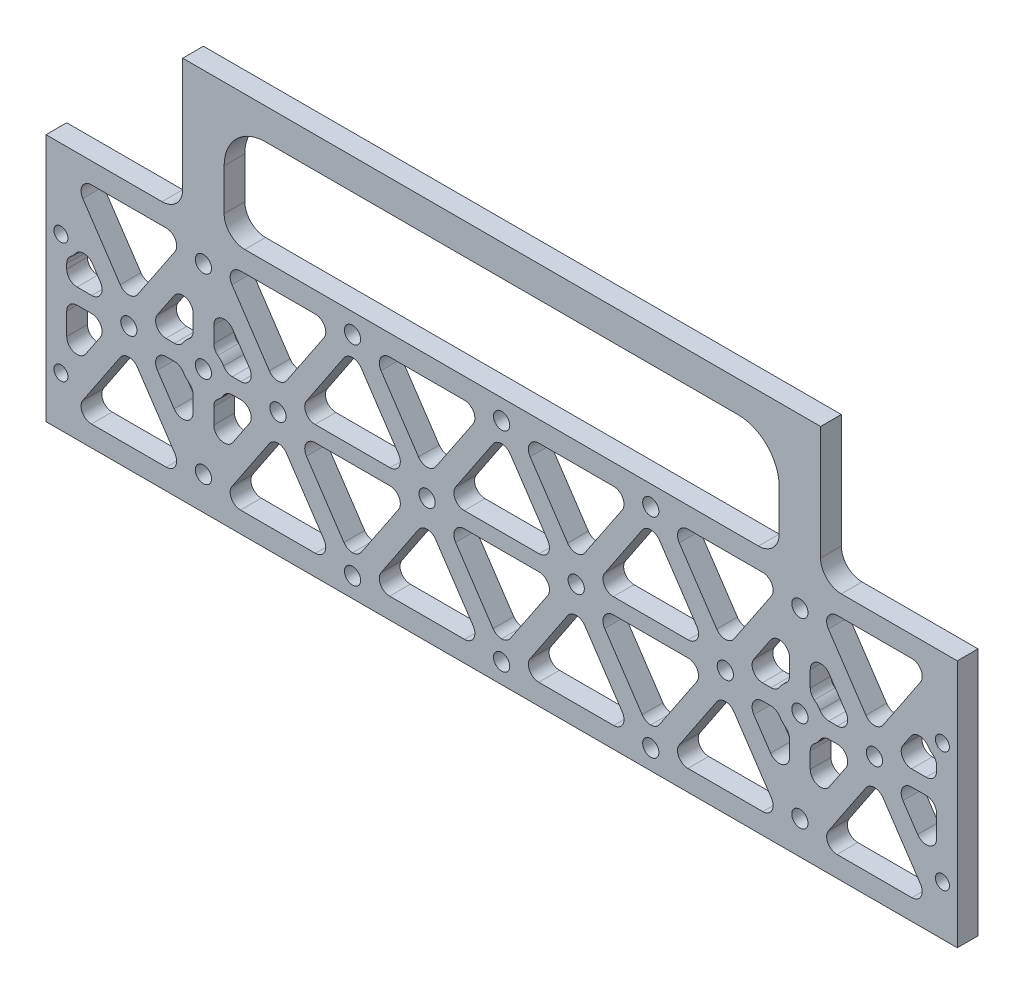
from build123d import *

# Parameters (mm, degrees)
SKETCH1_W              = 279.4
SKETCH1_H              = 76.2
BOSS_EXTRUDE1_DEPTH    = 6.35
F_10_CLEARANCE_HOLE1_D = 4.9784
BOSS_EXTRUDE2_DEPTH    = 6.35
FILLET1_R              = 12.7
FILLET1_OF_MIRROR1_R   = 12.7
FILLET2_R              = 6.35
FILLET3_R              = 6.35
F_8_CLEARANCE_HOLE1_D  = 4.3053
CUT_EXTRUDE1_DEPTH     = 161.800507229
FILLET4_R              = 3.175
FILLET5_R              = 3.175
SKETCH10_R             = 2.4892
CUT_EXTRUDE2_DEPTH     = 161.800507229


with BuildPart() as part:
    # Sketch1 → Boss-Extrude1 (new body)
    with BuildSketch(Plane.XY):
        Rectangle(SKETCH1_W, SKETCH1_H)
    extrude(amount=BOSS_EXTRUDE1_DEPTH)

    # #10 Clearance Hole1 (through all)
    with Locations(Plane.XY.offset(6.35)):
        with Locations((-91.44, 27.94), (-91.44, -27.94), (91.44, 27.94), (91.44, -27.94), (-91.44, 0), (91.44, 0)):
            Hole(F_10_CLEARANCE_HOLE1_D / 2)

    # Sketch5 → Boss-Extrude2 (add)
    with BuildSketch(Plane.XY.offset(6.35)):
        Polygon((-97.79, 47.271427301), (-97.79, 38.1), (-85.09, 38.1), (-85.09, 69.85), (-97.79, 69.85), align=None)
        Polygon((-97.79, 69.85), (-85.09, 69.85), (0, 69.85), (0, 79.375), (-97.79, 79.375), align=None)
    boss_extrude2 = extrude(amount=-BOSS_EXTRUDE2_DEPTH)

    # Fillet1
    fillet1_edges = [part.edges().sort_by_distance(p)[0] for p in [
        (-85.09, 69.85, 3.175),
    ]]
    fillet(fillet1_edges, radius=FILLET1_R)

    # Mirror1: Boss-Extrude2 across plane
    add(boss_extrude2.mirror(Plane(origin=(0, 0, 0), x_dir=(0, 0, 1), z_dir=(1, 0, 0))))

    # Fillet1 of Mirror1
    fillet1_of_mirror1_edges = [part.edges().sort_by_distance(p)[0] for p in [
        (85.09, 69.85, 3.175),
    ]]
    fillet(fillet1_of_mirror1_edges, radius=FILLET1_OF_MIRROR1_R)

    # Fillet2
    fillet2_edges = [part.edges().sort_by_distance(p)[0] for p in [
        (-85.09, 38.1, 3.175),
        (85.09, 38.1, 3.175),
    ]]
    fillet(fillet2_edges, radius=FILLET2_R)

    # Fillet3
    fillet3_edges = [part.edges().sort_by_distance(p)[0] for p in [
        (-97.79, 38.1, 3.175),
        (97.79, 38.1, 3.175),
    ]]
    fillet(fillet3_edges, radius=FILLET3_R)

    # #8 Clearance Hole1 (through all)
    with Locations(Plane.XY.offset(6.35)):
        with Locations((-135.128, 13.97), (-135.128, -22.86), (135.128, 13.97), (135.128, -22.86)):
            Hole(F_8_CLEARANCE_HOLE1_D / 2)

    # Sketch9 → Cut-Extrude1 (cut, through all)
    with BuildSketch(Plane.XY.offset(6.35)):
        with BuildLine():
            Line((-119.734892292, -2.413), (-133.35, -2.413))
            Line((-133.35, -2.413), (-133.35, -12.306016373))
            ThreePointArc((-133.35, -12.306016373), (-131.097668245, -15.343994041), (-127.536262482, -14.07171434))
            Line((-127.536262482, -14.07171434), (-119.734892292, -2.413))
        make_face()
        with BuildLine():
            Line((-133.35, 8.947792266), (-133.35, 2.413))
            Line((-133.35, 2.413), (-119.734892292, 2.413))
            Line((-119.734892292, 2.413), (-125.45428983, 10.960321877))
            ThreePointArc((-125.45428983, 10.960321877), (-128.082481922, 12.369606397), (-130.719977554, 10.977811397))
            ThreePointArc((-130.719977554, 10.977811397), (-131.872702342, 9.752549149), (-133.35, 8.947792266))
        make_face()
        with BuildLine():
            ThreePointArc((-100.180935541, 26.809302033), (-100.019073476, 30.070749637), (-102.819673059, 31.75))
            Line((-102.819673059, 31.75), (-125.780326941, 31.75))
            ThreePointArc((-125.780326941, 31.75), (-128.580926524, 30.070749637), (-128.419064459, 26.809302033))
            Line((-128.419064459, 26.809302033), (-114.3, 5.709144591))
            Line((-114.3, 5.709144591), (-100.180935541, 26.809302033))
        make_face()
        with BuildLine():
            Line((-51.154892292, 31.75), (-80.060326941, 31.75))
            ThreePointArc((-80.060326941, 31.75), (-82.860926524, 30.070749637), (-82.699064459, 26.809302033))
            Line((-82.699064459, 26.809302033), (-68.58, 5.709144591))
            Line((-68.58, 5.709144591), (-51.154892292, 31.75))
        make_face()
        with BuildLine():
            ThreePointArc((-94.615, 21.349740063), (-95.19394704, 21.661462538), (-95.742564124, 22.023912357))
            Line((-95.742564124, 22.023912357), (-108.865107708, 2.413))
            Line((-108.865107708, 2.413), (-98.345764407, 2.413))
            ThreePointArc((-98.345764407, 2.413), (-96.895990094, 4.872814704), (-94.615, 6.590259937))
            Line((-94.615, 6.590259937), (-94.615, 21.349740063))
        make_face()
        with BuildLine():
            Line((-74.014892292, 2.413), (-87.137435876, 22.023912357))
            ThreePointArc((-87.137435876, 22.023912357), (-87.68605296, 21.661462538), (-88.265, 21.349740063))
            Line((-88.265, 21.349740063), (-88.265, 6.590259937))
            ThreePointArc((-88.265, 6.590259937), (-85.984009906, 4.872814704), (-84.534235593, 2.413))
            Line((-84.534235593, 2.413), (-74.014892292, 2.413))
        make_face()
        with BuildLine():
            ThreePointArc((-94.615, -6.590259937), (-96.895990094, -4.872814704), (-98.345764407, -2.413))
            Line((-98.345764407, -2.413), (-108.865107708, -2.413))
            Line((-108.865107708, -2.413), (-95.742564124, -22.023912357))
            ThreePointArc((-95.742564124, -22.023912357), (-95.19394704, -21.661462538), (-94.615, -21.349740063))
            Line((-94.615, -21.349740063), (-94.615, -6.590259937))
        make_face()
        with BuildLine():
            ThreePointArc((-84.534235593, -2.413), (-85.984009906, -4.872814704), (-88.265, -6.590259937))
            Line((-88.265, -6.590259937), (-88.265, -21.349740063))
            ThreePointArc((-88.265, -21.349740063), (-87.68605296, -21.661462538), (-87.137435876, -22.023912357))
            Line((-87.137435876, -22.023912357), (-74.014892292, -2.413))
            Line((-74.014892292, -2.413), (-84.534235593, -2.413))
        make_face()
        with BuildLine():
            ThreePointArc((-102.819673059, -31.75), (-100.019073476, -30.070749637), (-100.180935541, -26.809302033))
            Line((-100.180935541, -26.809302033), (-114.3, -5.709144591))
            Line((-114.3, -5.709144591), (-128.419064459, -26.809302033))
            ThreePointArc((-128.419064459, -26.809302033), (-128.580926524, -30.070749637), (-125.780326941, -31.75))
            Line((-125.780326941, -31.75), (-102.819673059, -31.75))
        make_face()
        with BuildLine():
            ThreePointArc((-82.699064459, -26.809302033), (-82.860926524, -30.070749637), (-80.060326941, -31.75))
            Line((-80.060326941, -31.75), (-51.154892292, -31.75))
            Line((-51.154892292, -31.75), (-68.58, -5.709144591))
            Line((-68.58, -5.709144591), (-82.699064459, -26.809302033))
        make_face()
        Polygon((-44.01645363, 25.908), (-47.42354637, 25.908), (-63.145107708, 2.413), (-28.294892292, 2.413), align=None)
        Polygon((-22.86, 5.709144591), (-5.434892292, 31.75), (-40.285107708, 31.75), align=None)
        Polygon((1.70354637, 25.908), (-1.70354637, 25.908), (-17.425107708, 2.413), (17.425107708, 2.413), align=None)
        Polygon((22.86, 5.709144591), (40.285107708, 31.75), (5.434892292, 31.75), align=None)
        Polygon((47.42354637, 25.908), (44.01645363, 25.908), (28.294892292, 2.413), (63.145107708, 2.413), align=None)
        with BuildLine():
            ThreePointArc((82.699064459, 26.809302033), (82.860926524, 30.070749637), (80.060326941, 31.75))
            Line((80.060326941, 31.75), (51.154892292, 31.75))
            Line((51.154892292, 31.75), (68.58, 5.709144591))
            Line((68.58, 5.709144591), (82.699064459, 26.809302033))
        make_face()
        with BuildLine():
            Line((125.780326941, 31.75), (102.819673059, 31.75))
            ThreePointArc((102.819673059, 31.75), (100.019073476, 30.070749637), (100.180935541, 26.809302033))
            Line((100.180935541, 26.809302033), (114.3, 5.709144591))
            Line((114.3, 5.709144591), (128.419064459, 26.809302033))
            ThreePointArc((128.419064459, 26.809302033), (128.580926524, 30.070749637), (125.780326941, 31.75))
        make_face()
        with BuildLine():
            ThreePointArc((88.265, 21.349740063), (87.68605296, 21.661462538), (87.137435876, 22.023912357))
            Line((87.137435876, 22.023912357), (74.014892292, 2.413))
            Line((74.014892292, 2.413), (84.534235593, 2.413))
            ThreePointArc((84.534235593, 2.413), (85.984009906, 4.872814704), (88.265, 6.590259937))
            Line((88.265, 6.590259937), (88.265, 21.349740063))
        make_face()
        with BuildLine():
            Line((108.865107708, 2.413), (95.742564124, 22.023912357))
            ThreePointArc((95.742564124, 22.023912357), (95.19394704, 21.661462538), (94.615, 21.349740063))
            Line((94.615, 21.349740063), (94.615, 6.590259937))
            ThreePointArc((94.615, 6.590259937), (96.895990094, 4.872814704), (98.345764407, 2.413))
            Line((98.345764407, 2.413), (108.865107708, 2.413))
        make_face()
        with BuildLine():
            ThreePointArc((88.265, -6.590259937), (85.984009906, -4.872814704), (84.534235593, -2.413))
            Line((84.534235593, -2.413), (74.014892292, -2.413))
            Line((74.014892292, -2.413), (87.137435876, -22.023912357))
            ThreePointArc((87.137435876, -22.023912357), (87.68605296, -21.661462538), (88.265, -21.349740063))
            Line((88.265, -21.349740063), (88.265, -6.590259937))
        make_face()
        with BuildLine():
            ThreePointArc((98.345764407, -2.413), (96.895990094, -4.872814704), (94.615, -6.590259937))
            Line((94.615, -6.590259937), (94.615, -21.349740063))
            ThreePointArc((94.615, -21.349740063), (95.19394704, -21.661462538), (95.742564124, -22.023912357))
            Line((95.742564124, -22.023912357), (108.865107708, -2.413))
            Line((108.865107708, -2.413), (98.345764407, -2.413))
        make_face()
        with BuildLine():
            ThreePointArc((80.060326941, -31.75), (82.860926524, -30.070749637), (82.699064459, -26.809302033))
            Line((82.699064459, -26.809302033), (68.58, -5.709144591))
            Line((68.58, -5.709144591), (51.154892292, -31.75))
            Line((51.154892292, -31.75), (80.060326941, -31.75))
        make_face()
        with BuildLine():
            ThreePointArc((100.180935541, -26.809302033), (100.019073476, -30.070749637), (102.819673059, -31.75))
            Line((102.819673059, -31.75), (131.725107708, -31.75))
            Line((131.725107708, -31.75), (114.3, -5.709144591))
            Line((114.3, -5.709144591), (100.180935541, -26.809302033))
        make_face()
        with BuildLine():
            ThreePointArc((130.719977554, 10.977811397), (128.082481922, 12.369606397), (125.45428983, 10.960321877))
            Line((125.45428983, 10.960321877), (119.734892292, 2.413))
            Line((119.734892292, 2.413), (133.35, 2.413))
            Line((133.35, 2.413), (133.35, 8.947792266))
            ThreePointArc((133.35, 8.947792266), (131.872702342, 9.752549149), (130.719977554, 10.977811397))
        make_face()
        with BuildLine():
            Line((133.35, -12.306016373), (133.35, -2.413))
            Line((133.35, -2.413), (119.734892292, -2.413))
            Line((119.734892292, -2.413), (127.536262482, -14.07171434))
            ThreePointArc((127.536262482, -14.07171434), (131.097668245, -15.343994041), (133.35, -12.306016373))
        make_face()
        Polygon((63.145107708, -2.413), (28.294892292, -2.413), (44.01645363, -25.908), (47.42354637, -25.908), align=None)
        Polygon((40.285107708, -31.75), (22.86, -5.709144591), (5.434892292, -31.75), align=None)
        Polygon((17.425107708, -2.413), (-17.425107708, -2.413), (-1.70354637, -25.908), (1.70354637, -25.908), align=None)
        Polygon((-5.434892292, -31.75), (-22.86, -5.709144591), (-40.285107708, -31.75), align=None)
        Polygon((-28.294892292, -2.413), (-63.145107708, -2.413), (-47.42354637, -25.908), (-44.01645363, -25.908), align=None)
    extrude(amount=-CUT_EXTRUDE1_DEPTH, mode=Mode.SUBTRACT)

    # Fillet4
    # the kernel refuses this fillet: 3.175 mm, written as the material it adds along each edge
    with BuildSketch(Plane(origin=(133.35, -2.413, 6.35), x_dir=(0, -1, 0), z_dir=(0, 0, -1)), Plane(origin=(-133.35, 2.413, 6.35), x_dir=(0, 1, 0), z_dir=(0, 0, -1))) as fillet4_piece_1:
        with BuildLine():
            CenterArc((FILLET4_R, FILLET4_R), FILLET4_R, 180, 90)
            Line((0, FILLET4_R), (-FILLET4_R * 0.02, FILLET4_R))
            Line((-FILLET4_R * 0.02, FILLET4_R), (-FILLET4_R * 0.02, -FILLET4_R * 0.02))
            Line((-FILLET4_R * 0.02, -FILLET4_R * 0.02), (FILLET4_R, -FILLET4_R * 0.02))
            Line((FILLET4_R, -FILLET4_R * 0.02), (FILLET4_R, 0))
        make_face()
    extrude(amount=6.35)
    with BuildSketch(Plane(origin=(119.734892292, -2.413, 6.35), x_dir=(0.5561253440435254, -0.831098430820604, 0), z_dir=(0, 0, -1)), Plane(origin=(119.734892292, 2.413, 6.35), x_dir=(1, 0, 0), z_dir=(0, 0, -1)), Plane(origin=(108.865107708, 2.413, 6.35), x_dir=(-0.5561253440435254, 0.831098430820604, 0), z_dir=(0, 0, -1)), Plane(origin=(74.014892292, 2.413, 6.35), x_dir=(1, 0, 0), z_dir=(0, 0, -1)), Plane(origin=(74.014892292, -2.413, 6.35), x_dir=(0.5561253440435266, -0.8310984308206033, 0), z_dir=(0, 0, -1)), Plane(origin=(51.154892292, -31.75, 6.35), x_dir=(1, 0, 0), z_dir=(0, 0, -1)), Plane(origin=(51.154892292, 31.75, 6.35), x_dir=(0.5561253440435262, -0.8310984308206035, 0), z_dir=(0, 0, -1)), Plane(origin=(63.145107708, 2.413, 6.35), x_dir=(-0.5561253440435253, 0.8310984308206042, 0), z_dir=(0, 0, -1)), Plane(origin=(28.294892292, 2.413, 6.35), x_dir=(1, 0, 0), z_dir=(0, 0, -1)), Plane(origin=(63.145107708, -2.413, 6.35), x_dir=(-1, 0, 0), z_dir=(0, 0, -1)), Plane(origin=(28.294892292, -2.413, 6.35), x_dir=(0.5561253440435258, -0.831098430820604, 0), z_dir=(0, 0, -1)), Plane(origin=(5.434892292, -31.75, 6.35), x_dir=(1, 0, 0), z_dir=(0, 0, -1)), Plane(origin=(40.285107708, 31.75, 6.35), x_dir=(-1, 0, 0), z_dir=(0, 0, -1)), Plane(origin=(5.434892292, 31.75, 6.35), x_dir=(0.556125344043526, -0.8310984308206038, 0), z_dir=(0, 0, -1)), Plane(origin=(-17.425107708, 2.413, 6.35), x_dir=(1, 0, 0), z_dir=(0, 0, -1)), Plane(origin=(-17.425107708, -2.413, 6.35), x_dir=(0.5561253440435258, -0.8310984308206039, 0), z_dir=(0, 0, -1)), Plane(origin=(17.425107708, -2.413, 6.35), x_dir=(-1, 0, 0), z_dir=(0, 0, -1)), Plane(origin=(-5.434892292, -31.75, 6.35), x_dir=(-0.5561253440435255, 0.831098430820604, 0), z_dir=(0, 0, -1)), Plane(origin=(-40.285107708, -31.75, 6.35), x_dir=(1, 0, 0), z_dir=(0, 0, -1)), Plane(origin=(-40.285107708, 31.75, 6.35), x_dir=(0.5561253440435265, -0.8310984308206033, 0), z_dir=(0, 0, -1)), Plane(origin=(-28.294892292, 2.413, 6.35), x_dir=(-0.556125344043526, 0.8310984308206038, 0), z_dir=(0, 0, -1)), Plane(origin=(-63.145107708, 2.413, 6.35), x_dir=(1, 0, 0), z_dir=(0, 0, -1)), Plane(origin=(-51.154892292, 31.75, 6.35), x_dir=(-1, 0, 0), z_dir=(0, 0, -1)), Plane(origin=(-63.145107708, -2.413, 6.35), x_dir=(0.556125344043526, -0.8310984308206038, 0), z_dir=(0, 0, -1)), Plane(origin=(-51.154892292, -31.75, 6.35), x_dir=(-0.5561253440435254, 0.831098430820604, 0), z_dir=(0, 0, -1)), Plane(origin=(-74.014892292, -2.413, 6.35), x_dir=(-1, 0, 0), z_dir=(0, 0, -1)), Plane(origin=(-108.865107708, -2.413, 6.35), x_dir=(0.5561253440435259, -0.8310984308206039, 0), z_dir=(0, 0, -1)), Plane(origin=(-108.865107708, 2.413, 6.35), x_dir=(1, 0, 0), z_dir=(0, 0, -1)), Plane(origin=(-74.014892292, 2.413, 6.35), x_dir=(-0.5561253440435268, 0.8310984308206031, 0), z_dir=(0, 0, -1)), Plane(origin=(-119.734892292, 2.413, 6.35), x_dir=(-0.5561253440435258, 0.8310984308206039, 0), z_dir=(0, 0, -1)), Plane(origin=(131.725107708, -31.75, 6.35), x_dir=(-0.5561253440435258, 0.8310984308206039, 0), z_dir=(0, 0, -1))) as fillet4_piece_2:
        with BuildLine():
            CenterArc((FILLET4_R * 1.87237189524, -FILLET4_R), FILLET4_R, 90, 123.788260711)
            Line((FILLET4_R * 1.04127346442, -FILLET4_R * 1.55612534404), (FILLET4_R * 1.0246514958, -FILLET4_R * 1.56724785092))
            Line((FILLET4_R * 1.0246514958, -FILLET4_R * 1.56724785092), (-FILLET4_R * 0.0166219686164, -FILLET4_R * 0.0111225068809))
            Line((-FILLET4_R * 0.0166219686164, -FILLET4_R * 0.0111225068809), (0, FILLET4_R * 0.02))
            Line((0, FILLET4_R * 0.02), (FILLET4_R * 1.87237189524, FILLET4_R * 0.02))
            Line((FILLET4_R * 1.87237189524, FILLET4_R * 0.02), (FILLET4_R * 1.87237189524, 0))
        make_face()
    extrude(amount=6.35)
    with BuildSketch(Plane(origin=(133.35, 2.413, 6.35), x_dir=(0, 1, 0), z_dir=(0, 0, -1)), Plane(origin=(-133.35, -2.413, 6.35), x_dir=(0, -1, 0), z_dir=(0, 0, -1))) as fillet4_piece_3:
        with BuildLine():
            CenterArc((FILLET4_R, -FILLET4_R), FILLET4_R, 90, 90)
            Line((0, -FILLET4_R), (-FILLET4_R * 0.02, -FILLET4_R))
            Line((-FILLET4_R * 0.02, -FILLET4_R), (-FILLET4_R * 0.02, FILLET4_R * 0.02))
            Line((-FILLET4_R * 0.02, FILLET4_R * 0.02), (FILLET4_R, FILLET4_R * 0.02))
            Line((FILLET4_R, FILLET4_R * 0.02), (FILLET4_R, 0))
        make_face()
    extrude(amount=6.35)
    with BuildSketch(Plane(origin=(133.35, 8.947792266, 6.35), x_dir=(-0.8865120678199527, 0.4627054717739909, 0), z_dir=(0, 0, -1))) as fillet4_piece_4:
        with BuildLine():
            CenterArc((1.940690266, -3.143586467), FILLET4_R, 98.066458121, 54.371716965)
            Line((-0.873985549, -1.674496594), (-0.930279066, -1.645114797))
            Line((-0.930279066, -1.645114797), (-0.056293516, 0.029381797))
            Line((-0.056293516, 0.029381797), (0.008910424, 0.062871729))
            ThreePointArc((0.008910424, 0.062871729), (0.747584542, 0.010788092), (1.486258661, 0.062871729))
            Line((1.486258661, 0.062871729), (1.495169085, 0))
        make_face()
    extrude(amount=6.35)
    with BuildSketch(Plane(origin=(114.3, 5.709144591, 6.35), x_dir=(0.5561253440435259, 0.8310984308206039, 0), z_dir=(0, 0, -1)), Plane(origin=(114.3, -5.709144591, 6.35), x_dir=(-0.5561253440435256, -0.831098430820604, 0), z_dir=(0, 0, -1)), Plane(origin=(68.58, 5.709144591, 6.35), x_dir=(0.5561253440435259, 0.8310984308206039, 0), z_dir=(0, 0, -1)), Plane(origin=(22.86, -5.709144591, 6.35), x_dir=(-0.556125344043526, -0.8310984308206036, 0), z_dir=(0, 0, -1)), Plane(origin=(-22.86, 5.709144591, 6.35), x_dir=(0.5561253440435256, 0.8310984308206039, 0), z_dir=(0, 0, -1)), Plane(origin=(-68.58, -5.709144591, 6.35), x_dir=(-0.5561253440435256, -0.831098430820604, 0), z_dir=(0, 0, -1)), Plane(origin=(-114.3, 5.709144591, 6.35), x_dir=(0.5561253440435259, 0.8310984308206039, 0), z_dir=(0, 0, -1)), Plane(origin=(-114.3, -5.709144591, 6.35), x_dir=(-0.5561253440435259, -0.8310984308206039, 0), z_dir=(0, 0, -1))) as fillet4_piece_5:
        with BuildLine():
            CenterArc((FILLET4_R * 1.49444444444, -FILLET4_R), FILLET4_R, 90, 112.423478578)
            Line((FILLET4_R * 0.570054642896, -FILLET4_R * 1.38144920342), (FILLET4_R * 0.551566846865, -FILLET4_R * 1.38907818749))
            Line((FILLET4_R * 0.551566846865, -FILLET4_R * 1.38907818749), (-FILLET4_R * 0.0298888888889, FILLET4_R * 0.02))
            Line((-FILLET4_R * 0.0298888888889, FILLET4_R * 0.02), (FILLET4_R * 1.49444444444, FILLET4_R * 0.02))
            Line((FILLET4_R * 1.49444444444, FILLET4_R * 0.02), (FILLET4_R * 1.49444444444, 0))
        make_face()
    extrude(amount=6.35)
    with BuildSketch(Plane(origin=(98.345764407, 2.413, 6.35), x_dir=(-0.43403314616732697, 0.9008969019971661, 0), z_dir=(0, 0, -1)), Plane(origin=(-84.534235593, 2.413, 6.35), x_dir=(-0.43403314616732735, 0.9008969019971661, 0), z_dir=(0, 0, -1))) as fillet4_piece_6:
        with BuildLine():
            CenterArc((2.004340159, 3.154819332), FILLET4_R, 205.723787413, 57.812770894)
            Line((-0.856007505, 1.776764093), (-0.913214458, 1.749202988))
            Line((-0.913214458, 1.749202988), (-0.057206953, -0.027561105))
            Line((-0.057206953, -0.027561105), (0.007148146, -0.063096387))
            ThreePointArc((0.007148146, -0.063096387), (0.823466428, -0.017003742), (1.639784709, -0.063096387))
            Line((1.639784709, -0.063096387), (1.646932855, 0))
        make_face()
    extrude(amount=6.35)
    with BuildSketch(Plane(origin=(84.534235593, 2.413, 6.35), x_dir=(0.43403314616732214, 0.9008969019971685, 0), z_dir=(0, 0, -1)), Plane(origin=(-98.345764407, 2.413, 6.35), x_dir=(0.43403314616732214, 0.9008969019971685, 0), z_dir=(0, 0, -1))) as fillet4_piece_7:
        with BuildLine():
            CenterArc((2.004340159, -3.154819332), FILLET4_R, 96.463441693, 57.812770894)
            Line((-0.856007505, -1.776764093), (-0.913214458, -1.749202988))
            Line((-0.913214458, -1.749202988), (-0.057206953, 0.027561105))
            Line((-0.057206953, 0.027561105), (0.007148146, 0.063096387))
            ThreePointArc((0.007148146, 0.063096387), (0.823466428, 0.017003742), (1.639784709, 0.063096387))
            Line((1.639784709, 0.063096387), (1.646932855, 0))
        make_face()
    extrude(amount=6.35)
    with BuildSketch(Plane(origin=(95.742564124, 22.023912357, 6.35), x_dir=(-0.8582865078307712, -0.5131708004901091, 0), z_dir=(0, 0, -1)), Plane(origin=(87.137435876, -22.023912357, 6.35), x_dir=(0.8582865078307649, 0.51317080049012, 0), z_dir=(0, 0, -1)), Plane(origin=(-95.742564124, -22.023912357, 6.35), x_dir=(0.8582865078307624, 0.513170800490124, 0), z_dir=(0, 0, -1)), Plane(origin=(-87.137435876, 22.023912357, 6.35), x_dir=(-0.8582865078307709, -0.5131708004901099, 0), z_dir=(0, 0, -1))) as fillet4_piece_8:
        with BuildLine():
            CenterArc((3.043633884, -2.66234621), FILLET4_R, 123.014338954, 54.072667276)
            Line((-0.127263564, -2.500994512), (-0.190681513, -2.497767478))
            Line((-0.190681513, -2.497767478), (-0.063417949, 0.003227034))
            Line((-0.063417949, 0.003227034), (0.00570199, 0.063243476))
            ThreePointArc((0.00570199, 0.063243476), (0.656869305, 0.033948479), (1.279140705, 0.053246924))
            Line((1.279140705, 0.053246924), (1.31373861, 0))
        make_face()
    extrude(amount=6.35)
    with BuildSketch(Plane(origin=(87.137435876, 22.023912357, 6.35), x_dir=(0.8582865078307627, -0.5131708004901235, 0), z_dir=(0, 0, -1)), Plane(origin=(-95.742564124, 22.023912357, 6.35), x_dir=(0.8582865078307592, -0.5131708004901295, 0), z_dir=(0, 0, -1))) as fillet4_piece_9:
        with BuildLine():
            CenterArc((3.043633884, 2.66234621), FILLET4_R, 182.912993771, 54.072667276)
            Line((-0.127263564, 2.500994512), (-0.190681513, 2.497767478))
            Line((-0.190681513, 2.497767478), (-0.063417949, -0.003227034))
            Line((-0.063417949, -0.003227034), (0.00570199, -0.063243476))
            ThreePointArc((0.00570199, -0.063243476), (0.656869305, -0.033948479), (1.279140705, -0.053246924))
            Line((1.279140705, -0.053246924), (1.31373861, 0))
        make_face()
    extrude(amount=6.35)
    with BuildSketch(Plane(origin=(95.742564124, -22.023912357, 6.35), x_dir=(0.5561253440435234, 0.8310984308206055, 0), z_dir=(0, 0, -1)), Plane(origin=(-87.137435876, -22.023912357, 6.35), x_dir=(0.5561253440435286, 0.831098430820602, 0), z_dir=(0, 0, -1))) as fillet4_piece_10:
        with BuildLine():
            CenterArc((2.504230333, -3.175), FILLET4_R, 90, 54.072667276)
            Line((-0.066763451, -1.312041073), (-0.118183326, -1.274781895))
            ThreePointArc((-0.118183326, -1.274781895), (-0.067286338, -0.654295294), (-0.063451529, -0.002480625))
            Line((-0.063451529, -0.002480625), (0, 0.0635))
            Line((0, 0.0635), (2.504230333, 0.0635))
            Line((2.504230333, 0.0635), (2.504230333, 0))
        make_face()
    extrude(amount=6.35)
    with BuildSketch(Plane(origin=(68.58, -5.709144591, 6.35), x_dir=(0.5561253440435259, -0.8310984308206039, 0), z_dir=(0, 0, -1)), Plane(origin=(22.86, 5.709144591, 6.35), x_dir=(-0.5561253440435268, 0.8310984308206033, 0), z_dir=(0, 0, -1)), Plane(origin=(-22.86, -5.709144591, 6.35), x_dir=(0.5561253440435251, -0.8310984308206042, 0), z_dir=(0, 0, -1)), Plane(origin=(-68.58, 5.709144591, 6.35), x_dir=(-0.5561253440435268, 0.8310984308206033, 0), z_dir=(0, 0, -1))) as fillet4_piece_11:
        with BuildLine():
            CenterArc((FILLET4_R * 1.49444444444, FILLET4_R), FILLET4_R, 157.576521422, 112.423478578)
            Line((FILLET4_R * 0.570054642896, FILLET4_R * 1.38144920342), (FILLET4_R * 0.551566846865, FILLET4_R * 1.38907818749))
            Line((FILLET4_R * 0.551566846865, FILLET4_R * 1.38907818749), (-FILLET4_R * 0.0298888888889, -FILLET4_R * 0.02))
            Line((-FILLET4_R * 0.0298888888889, -FILLET4_R * 0.02), (FILLET4_R * 1.49444444444, -FILLET4_R * 0.02))
            Line((FILLET4_R * 1.49444444444, -FILLET4_R * 0.02), (FILLET4_R * 1.49444444444, 0))
        make_face()
    extrude(amount=6.35)
    with BuildSketch(Plane(origin=(40.285107708, -31.75, 6.35), x_dir=(-1, 0, 0), z_dir=(0, 0, -1)), Plane(origin=(17.425107708, 2.413, 6.35), x_dir=(-1, 0, 0), z_dir=(0, 0, -1)), Plane(origin=(-5.434892292, 31.75, 6.35), x_dir=(-0.5561253440435258, -0.8310984308206038, 0), z_dir=(0, 0, -1)), Plane(origin=(-28.294892292, -2.413, 6.35), x_dir=(-0.5561253440435259, -0.8310984308206038, 0), z_dir=(0, 0, -1)), Plane(origin=(-119.734892292, -2.413, 6.35), x_dir=(-0.5561253440435264, -0.8310984308206035, 0), z_dir=(0, 0, -1))) as fillet4_piece_12:
        with BuildLine():
            CenterArc((FILLET4_R * 1.87237189524, FILLET4_R), FILLET4_R, 146.211739289, 123.788260711)
            Line((FILLET4_R * 1.04127346442, FILLET4_R * 1.55612534404), (FILLET4_R * 1.0246514958, FILLET4_R * 1.56724785092))
            Line((FILLET4_R * 1.0246514958, FILLET4_R * 1.56724785092), (-FILLET4_R * 0.0166219686164, FILLET4_R * 0.0111225068809))
            Line((-FILLET4_R * 0.0166219686164, FILLET4_R * 0.0111225068809), (0, -FILLET4_R * 0.02))
            Line((0, -FILLET4_R * 0.02), (FILLET4_R * 1.87237189524, -FILLET4_R * 0.02))
            Line((FILLET4_R * 1.87237189524, -FILLET4_R * 0.02), (FILLET4_R * 1.87237189524, 0))
        make_face()
    extrude(amount=6.35)
    with BuildSketch(Plane(origin=(-133.35, 8.947792266, 6.35), x_dir=(0, -1, 0), z_dir=(0, 0, -1))) as fillet4_piece_13:
        with BuildLine():
            CenterArc((1.888859334, -3.175), FILLET4_R, 90, 54.371716965)
            Line((-0.691822917, -1.325485437), (-0.743436562, -1.288495146))
            ThreePointArc((-0.743436562, -1.288495146), (-0.355475232, -0.657751009), (-0.059859449, 0.021191895))
            Line((-0.059859449, 0.021191895), (0, 0.0635))
            Line((0, 0.0635), (1.888859334, 0.0635))
            Line((1.888859334, 0.0635), (1.888859334, 0))
        make_face()
    extrude(amount=6.35)
    with BuildSketch(Plane(origin=(47.42354637, -25.908, 6.35), x_dir=(-1, 0, 0), z_dir=(0, 0, -1)), Plane(origin=(1.70354637, -25.908, 6.35), x_dir=(-1, 0, 0), z_dir=(0, 0, -1)), Plane(origin=(47.42354637, 25.908, 6.35), x_dir=(0.5561253440435431, -0.8310984308205922, 0), z_dir=(0, 0, -1)), Plane(origin=(-47.42354637, 25.908, 6.35), x_dir=(1, 0, 0), z_dir=(0, 0, -1))) as fillet4_piece_14:
        with BuildLine():
            CenterArc((FILLET4_R * 0.534081932411, FILLET4_R), FILLET4_R, 213.788260711, 56.211739289)
            Line((-FILLET4_R * 0.29701649841, FILLET4_R * 0.443874655956), (-FILLET4_R * 0.313638467026, FILLET4_R * 0.432752149076))
            Line((-FILLET4_R * 0.313638467026, FILLET4_R * 0.432752149076), (-FILLET4_R * 0.0106816386482, -FILLET4_R * 0.02))
            Line((-FILLET4_R * 0.0106816386482, -FILLET4_R * 0.02), (FILLET4_R * 0.534081932411, -FILLET4_R * 0.02))
            Line((FILLET4_R * 0.534081932411, -FILLET4_R * 0.02), (FILLET4_R * 0.534081932411, 0))
        make_face()
    extrude(amount=6.35)
    with BuildSketch(Plane(origin=(44.01645363, -25.908, 6.35), x_dir=(1, 0, 0), z_dir=(0, 0, -1)), Plane(origin=(-1.70354637, -25.908, 6.35), x_dir=(1, 0, 0), z_dir=(0, 0, -1)), Plane(origin=(-44.01645363, -25.908, 6.35), x_dir=(0.5561253440435383, 0.8310984308205955, 0), z_dir=(0, 0, -1)), Plane(origin=(-47.42354637, -25.908, 6.35), x_dir=(1, 0, 0), z_dir=(0, 0, -1)), Plane(origin=(44.01645363, 25.908, 6.35), x_dir=(-0.5561253440435044, -0.8310984308206182, 0), z_dir=(0, 0, -1)), Plane(origin=(-44.01645363, 25.908, 6.35), x_dir=(-1, 0, 0), z_dir=(0, 0, -1)), Plane(origin=(1.70354637, 25.908, 6.35), x_dir=(-1, 0, 0), z_dir=(0, 0, -1)), Plane(origin=(-1.70354637, 25.908, 6.35), x_dir=(-0.5561253440435228, -0.831098430820606, 0), z_dir=(0, 0, -1))) as fillet4_piece_15:
        with BuildLine():
            CenterArc((FILLET4_R * 0.534081932411, -FILLET4_R), FILLET4_R, 90, 56.211739289)
            Line((-FILLET4_R * 0.29701649841, -FILLET4_R * 0.443874655956), (-FILLET4_R * 0.313638467026, -FILLET4_R * 0.432752149076))
            Line((-FILLET4_R * 0.313638467026, -FILLET4_R * 0.432752149076), (-FILLET4_R * 0.0106816386482, FILLET4_R * 0.02))
            Line((-FILLET4_R * 0.0106816386482, FILLET4_R * 0.02), (FILLET4_R * 0.534081932411, FILLET4_R * 0.02))
            Line((FILLET4_R * 0.534081932411, FILLET4_R * 0.02), (FILLET4_R * 0.534081932411, 0))
        make_face()
    extrude(amount=6.35)

    # Fillet5
    # the kernel refuses this fillet: 3.175 mm, written as the material it adds along each edge
    with BuildSketch(Plane(origin=(-88.265, -21.349740063, 6.35), x_dir=(0, 1, 0), z_dir=(0, 0, -1)), Plane(origin=(-94.615, 21.349740063, 6.35), x_dir=(0, -1, 0), z_dir=(0, 0, -1))) as fillet5_piece_1:
        with BuildLine():
            CenterArc((8.094751468, 3.175), FILLET5_R, 123.788260711, 146.211739289)
            Line((6.3290535, 5.813737518), (6.152483703, 6.07761127))
            ThreePointArc((6.152483703, 6.07761127), (1.23051981, 2.784103831), (-0.317278757, 0.011850744))
            Line((-0.317278757, 0.011850744), (0, -0.3175))
            Line((0, -0.3175), (8.094751468, -0.3175))
            Line((8.094751468, -0.3175), (8.094751468, 0))
        make_face()
    extrude(amount=6.35)
    with BuildSketch(Plane(origin=(-94.615, -21.349740063, 6.35), x_dir=(0, 1, 0), z_dir=(0, 0, -1)), Plane(origin=(-88.265, 21.349740063, 6.35), x_dir=(0, -1, 0), z_dir=(0, 0, -1)), Plane(origin=(88.265, -21.349740063, 6.35), x_dir=(0, 1, 0), z_dir=(0, 0, -1))) as fillet5_piece_2:
        with BuildLine():
            CenterArc((8.094751468, -3.175), FILLET5_R, 90, 146.211739289)
            Line((6.3290535, -5.813737518), (6.152483703, -6.07761127))
            ThreePointArc((6.152483703, -6.07761127), (1.23051981, -2.784103831), (-0.317278757, -0.011850744))
            Line((-0.317278757, -0.011850744), (0, 0.3175))
            Line((0, 0.3175), (8.094751468, 0.3175))
            Line((8.094751468, 0.3175), (8.094751468, 0))
        make_face()
    extrude(amount=6.35)
    with BuildSketch(Plane(origin=(-94.615, 6.590259937, 6.35), x_dir=(0, 1, 0), z_dir=(0, 0, -1)), Plane(origin=(88.265, 6.590259937, 6.35), x_dir=(0, 1, 0), z_dir=(0, 0, -1)), Plane(origin=(94.615, -6.590259937, 6.35), x_dir=(0, -1, 0), z_dir=(0, 0, -1))) as fillet5_piece_3:
        with BuildLine():
            CenterArc((1.759697909, -3.175), FILLET5_R, 90, 52.747632669)
            ThreePointArc((-0.767529042, -1.253087167), (-0.352220003, -0.645864932), (0, 0))
            Line((0, 0), (1.759697909, 0))
        make_face()
    extrude(amount=6.35)
    with BuildSketch(Plane(origin=(-94.615, -6.590259937, 6.35), x_dir=(0, -1, 0), z_dir=(0, 0, -1)), Plane(origin=(88.265, -6.590259937, 6.35), x_dir=(0, -1, 0), z_dir=(0, 0, -1)), Plane(origin=(94.615, 6.590259937, 6.35), x_dir=(0, 1, 0), z_dir=(0, 0, -1))) as fillet5_piece_4:
        with BuildLine():
            CenterArc((1.759697909, 3.175), FILLET5_R, 217.252367331, 52.747632669)
            ThreePointArc((-0.767529042, 1.253087167), (-0.352220003, 0.645864932), (0, 0))
            Line((0, 0), (1.759697909, 0))
        make_face()
    extrude(amount=6.35)
    with BuildSketch(Plane(origin=(-84.534235593, -2.413, 6.35), x_dir=(1, 0, 0), z_dir=(0, 0, -1)), Plane(origin=(98.345764407, -2.413, 6.35), x_dir=(1, 0, 0), z_dir=(0, 0, -1))) as fillet5_piece_5:
        with BuildLine():
            CenterArc((1.972216898, 3.175), FILLET5_R, 212.187229106, 57.812770894)
            ThreePointArc((-0.714823449, 1.483716707), (-0.315523389, 0.762039271), (0, 0))
            Line((0, 0), (1.972216898, 0))
        make_face()
    extrude(amount=6.35)
    with BuildSketch(Plane(origin=(-98.345764407, -2.413, 6.35), x_dir=(0.4340331461673148, -0.9008969019971721, 0), z_dir=(0, 0, -1)), Plane(origin=(84.534235593, -2.413, 6.35), x_dir=(0.4340331461673148, -0.9008969019971721, 0), z_dir=(0, 0, -1))) as fillet5_piece_6:
        with BuildLine():
            CenterArc((2.004340159, 3.154819332), FILLET5_R, 205.723787413, 57.812770894)
            Line((-0.856007505, 1.776764093), (0, 0))
            ThreePointArc((0, 0), (0.823466428, 0.046496258), (1.646932855, 0))
        make_face()
    extrude(amount=6.35)
    with BuildSketch(Plane(origin=(-88.265, 6.590259937, 6.35), x_dir=(0.852750428388296, -0.5223185875340621, 0), z_dir=(0, 0, -1))) as fillet5_piece_7:
        with BuildLine():
            CenterArc((1.788359684, -3.158944661), FILLET5_R, 95.764460669, 52.747632669)
            Line((-0.919122927, -1.500583146), (0, 0))
            ThreePointArc((0, 0), (0.734732652, -0.0369915), (1.469465304, 0))
        make_face()
    extrude(amount=6.35)
    with BuildSketch(Plane(origin=(-88.265, -6.590259937, 6.35), x_dir=(0.8527504283882958, 0.5223185875340625, 0), z_dir=(0, 0, -1))) as fillet5_piece_8:
        with BuildLine():
            CenterArc((1.788359684, 3.158944661), FILLET5_R, 211.487906661, 52.747632669)
            Line((-0.919122927, 1.500583146), (0, 0))
            ThreePointArc((0, 0), (0.734732652, 0.0369915), (1.469465304, 0))
        make_face()
    extrude(amount=6.35)
    with BuildSketch(Plane(origin=(108.865107708, -2.413, 6.35), x_dir=(-0.556125344043526, -0.8310984308206036, 0), z_dir=(0, 0, -1))) as fillet5_piece_9:
        with BuildLine():
            CenterArc((FILLET5_R * 1.87237189524, FILLET5_R), FILLET5_R, 146.211739289, 123.788260711)
            Line((FILLET5_R * 1.04127346442, FILLET5_R * 1.55612534404), (0, 0))
            Line((0, 0), (FILLET5_R * 1.87237189524, 0))
        make_face()
    extrude(amount=6.35)
    with BuildSketch(Plane(origin=(94.615, -21.349740063, 6.35), x_dir=(0.6764896709995282, 0.736452119985373, 0), z_dir=(0, 0, -1)), Plane(origin=(88.265, 21.349740063, 6.35), x_dir=(-0.6764896709995348, -0.7364521199853666, 0), z_dir=(0, 0, -1))) as fillet5_piece_10:
        with BuildLine():
            CenterArc((8.109251584, -3.137780276), FILLET5_R, 81.218321891, 146.211739289)
            Line((5.961396879, -5.476015757), (5.746611408, -5.709839305))
            Line((5.746611408, -5.709839305), (-0.214785471, -0.233823548))
            Line((-0.214785471, -0.233823548), (-0.225643708, 0.223363308))
            ThreePointArc((-0.225643708, 0.223363308), (2.789636407, 1.217925228), (8.642450915, 0.313778028))
            Line((8.642450915, 0.313778028), (8.593978248, 0))
        make_face()
    extrude(amount=6.35)
    with BuildSketch(Plane(origin=(94.615, 21.349740063, 6.35), x_dir=(0.6764896709995292, -0.7364521199853722, 0), z_dir=(0, 0, -1))) as fillet5_piece_11:
        with BuildLine():
            CenterArc((8.109251584, 3.137780276), FILLET5_R, 132.56993882, 146.211739289)
            Line((5.961396879, 5.476015757), (5.746611408, 5.709839305))
            Line((5.746611408, 5.709839305), (-0.214785471, 0.233823548))
            Line((-0.214785471, 0.233823548), (-0.225643708, -0.223363308))
            ThreePointArc((-0.225643708, -0.223363308), (2.789636407, -1.217925228), (8.642450915, -0.313778028))
            Line((8.642450915, -0.313778028), (8.593978248, 0))
        make_face()
    extrude(amount=6.35)

    # Sketch10 → Cut-Extrude2 (cut, through all)
    with BuildSketch(Plane.XY.offset(6.35)):
        with Locations((-114.3, 0)):
            Circle(SKETCH10_R)
        with Locations((-68.58, 0)):
            Circle(SKETCH10_R)
        with Locations((-22.86, 0)):
            Circle(SKETCH10_R)
        with Locations((22.86, 0)):
            Circle(SKETCH10_R)
        with Locations((68.58, 0)):
            Circle(SKETCH10_R)
        with Locations((114.3, 0)):
            Circle(SKETCH10_R)
        with Locations((-45.72, 32.004)):
            Circle(SKETCH10_R)
        with Locations((-45.72, -32.004)):
            Circle(SKETCH10_R)
        with Locations((0, 32.004)):
            Circle(SKETCH10_R)
        with Locations((45.72, 32.004)):
            Circle(SKETCH10_R)
        with Locations((0, -32.004)):
            Circle(SKETCH10_R)
        with Locations((45.72, -32.004)):
            Circle(SKETCH10_R)
    extrude(amount=-CUT_EXTRUDE2_DEPTH, mode=Mode.SUBTRACT)


solid = part.part
